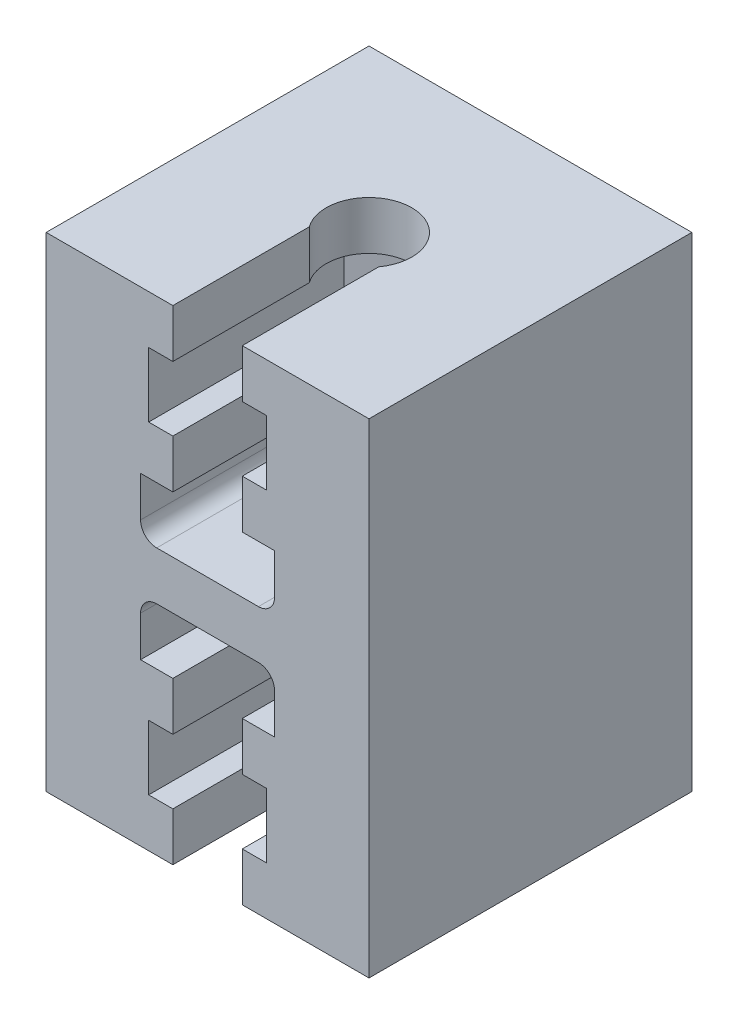
from build123d import *

# Parameters (mm, degrees)
BOSS_EXTRUDE1_DEPTH      = 10
BOSS_EXTRUDE1_DEPTH_BACK = 10
SKETCH1_W                = 20
SKETCH1_H                = 30
SKETCH3_R                = 2.65
CUT_EXTRUDE1_DEPTH       = 34.166247904
CUT_EXTRUDE2_DEPTH       = 21.615528201
CUT_EXTRUDE3_DEPTH       = 2


with BuildPart() as part:
    # Sketch1 → Boss-Extrude1 (new, two sides: drawn at the far end of the back side and taken through both)
    with BuildSketch(Plane.XY.offset(-BOSS_EXTRUDE1_DEPTH_BACK)):
        Rectangle(SKETCH1_W, SKETCH1_H)
    extrude(amount=BOSS_EXTRUDE1_DEPTH + BOSS_EXTRUDE1_DEPTH_BACK)

    # Sketch2 → Cut-Revolve1 (revolve, cut)
    with BuildSketch(Plane.XY):
        with BuildLine():
            Line((0, -15), (2.15, -15))
            Line((2.15, -15), (2.15, -5))
            Line((2.15, -5), (4.15, -5))
            add(Edge.make_bspline(
                [(4.15, -5), (4.15, -2.631789503), (2.470229684, -1.5), (0, -1.5)],
                knots=[0, 0, 0, 0, 1, 1, 1, 1], degree=3))
            Line((0, -1.5), (0, -15))
        make_face()
    revolve(axis=Axis((0, 15, 0), (0, -1, 0)), mode=Mode.SUBTRACT)

    # Sketch3 → Cut-Extrude1 (cut, through all)
    with BuildSketch(Plane(origin=(0, 15, 0), x_dir=(1, 0, 0), z_dir=(0, 1, 0))):
        Circle(SKETCH3_R)
    extrude(amount=-CUT_EXTRUDE1_DEPTH, mode=Mode.SUBTRACT)

    # Sketch4 → Cut-Extrude2 (cut, through all)
    with BuildSketch(Plane.XY):
        with BuildLine():
            Line((-2.15, -15), (2.15, -15))
            Line((2.15, -15), (2.15, -5))
            Line((2.15, -5), (4.15, -5))
            Line((4.15, -5), (4.15, -2.5))
            ThreePointArc((4.15, -2.5), (3.857106781, -1.792893219), (3.15, -1.5))
            Line((3.15, -1.5), (0, -1.5))
            Line((0, -1.5), (-3.15, -1.5))
            ThreePointArc((-3.15, -1.5), (-3.857106781, -1.792893219), (-4.15, -2.5))
            Line((-4.15, -2.5), (-4.15, -5))
            Line((-4.15, -5), (-2.15, -5))
            Line((-2.15, -5), (-2.15, -15))
        make_face()
    cut_extrude2 = extrude(amount=CUT_EXTRUDE2_DEPTH, mode=Mode.SUBTRACT)

    # Sketch5 → Cut-Extrude3 (cut, symmetric)
    with BuildSketch(Plane(origin=(0, -10, 0), x_dir=(-1, 0, 0), z_dir=(0, -1, 0))):
        Polygon((-3.65, -2.107328483), (-3.65, -10), (3.65, -10), (3.65, -2.107328483), (3.65, 2.107328483), (0, 4.214656965), (-3.65, 2.107328483), align=None)
    cut_extrude3 = extrude(amount=CUT_EXTRUDE3_DEPTH, both=True, mode=Mode.SUBTRACT)

    # Mirror1: Cut-Extrude2, Cut-Extrude3 across plane
    add(cut_extrude2.mirror(Plane.ZX), mode=Mode.SUBTRACT)
    add(cut_extrude3.mirror(Plane.ZX), mode=Mode.SUBTRACT)


solid = part.part
